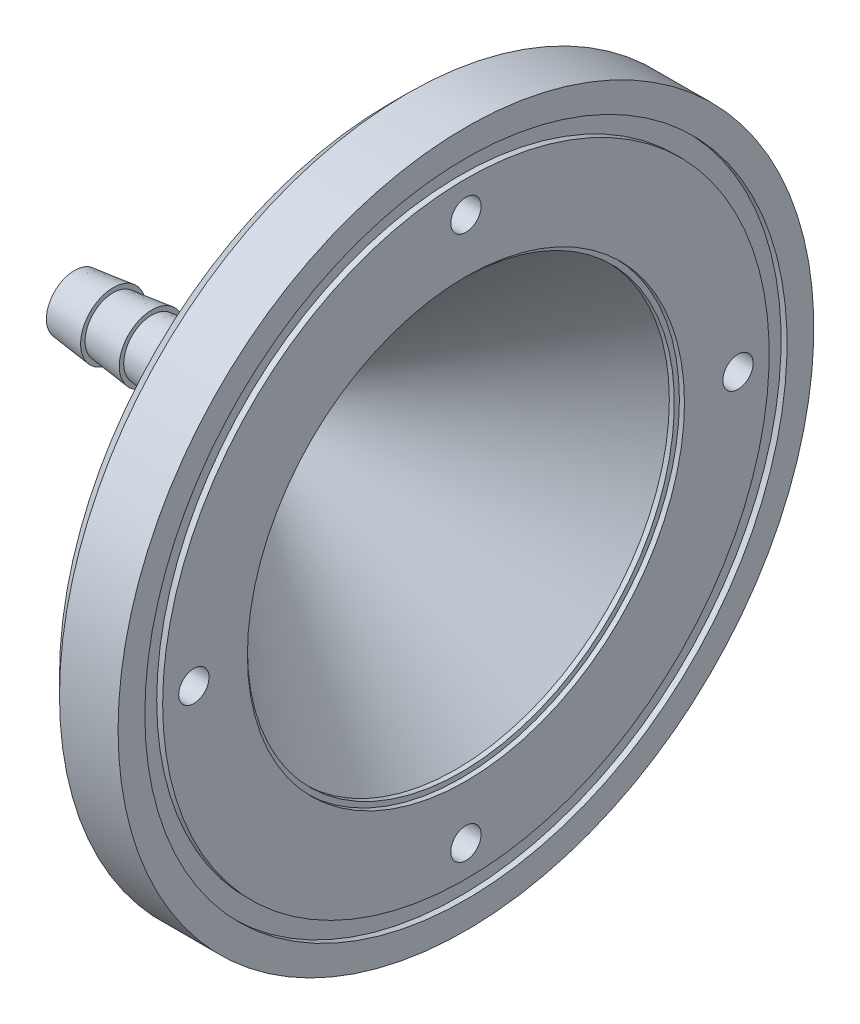
from build123d import *

# Parameters (mm, degrees)
CBORE_FOR_M3_HEX_SOCKET_HEAD_CAP_SCREW2_D           = 3.4
CBORE_FOR_M3_HEX_SOCKET_HEAD_CAP_SCREW2_DEPTH       = 8.566
CBORE_FOR_M3_HEX_SOCKET_HEAD_CAP_SCREW2_CBORE_D     = 6.5
CBORE_FOR_M3_HEX_SOCKET_HEAD_CAP_SCREW2_CBORE_DEPTH = 3.4
CBORE_FOR_M3_HEX_SOCKET_HEAD_CAP_SCREW2_TIP         = 1.021463052
CHAMFER1_SIZE                                       = 2


with BuildPart() as part:
    # Sketch1 → Revolve17 (revolve)
    with BuildSketch(Plane.XY):
        Polygon((-14.175209939, 3.15), (-14.175209939, 3.65), (-18.508543272, 3.15), (-18.508543272, 1.9), (0, 1.9), (24.243150592, 23.934), (24.809150592, 23.934), (24.809150592, 24.5), (25.375150592, 24.5), (25.375150592, 34), (24.708150592, 34), (24.708150592, 36), (25.375150592, 36), (25.375150592, 39), (16.809150592, 39), (16.809150592, 23.934), (-5.508543272, 3.65), (-9.841876606, 3.15), (-9.841876606, 3.65), align=None)
    revolve(axis=Axis((-801.920554309, 0, 0), (1, 0, 0)))

    # CBORE for M3 Hex Socket Head Cap Screw2
    with Locations(Plane.ZY.offset(-16.809150592)):
        with Locations((0, -30.5), (0, 30.5), (30.5, 0), (-30.5, 0)):
            CounterBoreHole(CBORE_FOR_M3_HEX_SOCKET_HEAD_CAP_SCREW2_D / 2, CBORE_FOR_M3_HEX_SOCKET_HEAD_CAP_SCREW2_CBORE_D / 2, CBORE_FOR_M3_HEX_SOCKET_HEAD_CAP_SCREW2_CBORE_DEPTH, depth=CBORE_FOR_M3_HEX_SOCKET_HEAD_CAP_SCREW2_DEPTH)
            with Locations((0, 0, -(CBORE_FOR_M3_HEX_SOCKET_HEAD_CAP_SCREW2_DEPTH + CBORE_FOR_M3_HEX_SOCKET_HEAD_CAP_SCREW2_TIP / 2))):  # 118° drill point
                Cone(0, CBORE_FOR_M3_HEX_SOCKET_HEAD_CAP_SCREW2_D / 2, CBORE_FOR_M3_HEX_SOCKET_HEAD_CAP_SCREW2_TIP, mode=Mode.SUBTRACT)

    # Chamfer1
    chamfer1_edges = [part.edges().sort_by_distance(p)[0] for p in [
        (16.809150592, -39, 0),
    ]]
    chamfer(chamfer1_edges, length=CHAMFER1_SIZE)


solid = part.part
